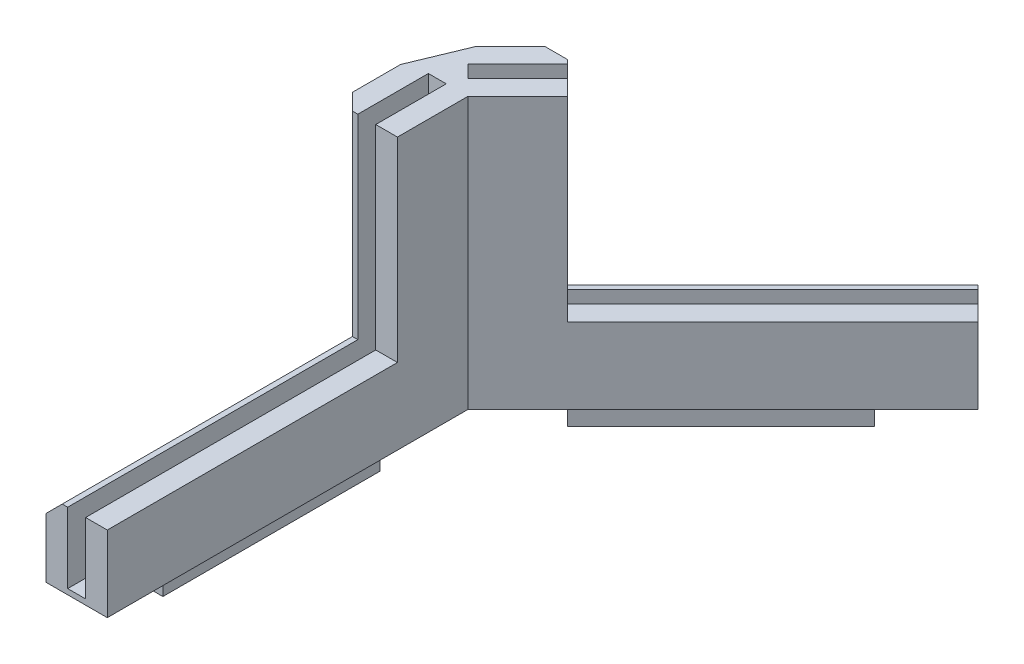
from build123d import *

# Parameters (mm, degrees)
BOSS_EXTRUDE1_DEPTH = 50
SKETCH3_W           = 3.3
SKETCH3_H           = 1
BOSS_EXTRUDE2_DEPTH = 13
BOSS_EXTRUDE3_DEPTH = 53.5
SKETCH6_W           = 4.8
SKETCH6_H           = 40
BOSS_EXTRUDE4_DEPTH = 5
CHAMFER1_START      = -14
CHAMFER1_OUTLINE_W  = 52
CHAMFER1_OUTLINE_H  = 13
CHAMFER1_DEPTH      = 3.182909169
CHAMFER2_SIZE       = 3


with BuildPart() as part:
    # Sketch2 → Boss-Extrude1 (new body)
    with BuildSketch(Plane(origin=(0, 0, 0), x_dir=(1, 0, 0), z_dir=(0, 1, 0))):
        Polygon((-1.7, -2), (-1.7, -15), (-5.7, -15), (-5.7, -2), (-9, -2), (-9, -15), (-13, -15), (-13, 2.680601608), align=None)
    extrude(amount=BOSS_EXTRUDE1_DEPTH)

    # Sketch3 → Boss-Extrude2 (add)
    with BuildSketch(Plane.XY.offset(2)):
        with Locations((-7.35, 0.5)):
            Rectangle(SKETCH3_W, SKETCH3_H)
    extrude(amount=BOSS_EXTRUDE2_DEPTH)

    # Sketch5 → Boss-Extrude3 (add)
    with BuildSketch(Plane.XY.offset(15)):
        Polygon((-13, 0), (-1.7, 0), (-1.7, 14), (-5.7, 14), (-5.7, 1), (-9, 1), (-9, 14), (-13, 14), align=None)
    extrude(amount=BOSS_EXTRUDE3_DEPTH)

    # Sketch6 → Boss-Extrude4 (add)
    with BuildSketch(Plane(origin=(0, 0, 0), x_dir=(-1, 0, 0), z_dir=(0, -1, 0))):
        with Locations((7.35, -35)):
            Rectangle(SKETCH6_W, SKETCH6_H)
    extrude(amount=BOSS_EXTRUDE4_DEPTH)

    # Mirror1: part across plane


with BuildPart() as part_1:
    add(part.part)
    add(part.part.mirror(Plane(origin=(-0.956063716, 0, 2.308147732), x_dir=(0.9238798691632129, 0, 0.38268261961443256), z_dir=(0.3826826196144326, 0, -0.9238798691632131))))

    # Chamfer1: read off the stored shape, not the designer's step
    # Chamfer1 outline → Chamfer1 (cut)
    with BuildSketch(Plane(origin=(0, 0, 0), x_dir=(0, 1, 0), z_dir=(0.9238798691632129, 0, 0.38268261961443295)).offset(CHAMFER1_START)):
        with Locations((25, 2.5)):
            Rectangle(CHAMFER1_OUTLINE_W, CHAMFER1_OUTLINE_H)
    extrude(amount=CHAMFER1_DEPTH, mode=Mode.SUBTRACT)

    # Chamfer2
    chamfer2_edges = [part_1.edges().sort_by_distance(p)[0] for p in [
        (-13, 32, 15),
        (-13, 14, 41.75),
        (-0.497948704, 32, -15.182696898),
        (18.417124413, 14, -34.097836574),
    ]]
    chamfer(chamfer2_edges, length=CHAMFER2_SIZE)


solid = part_1.part
